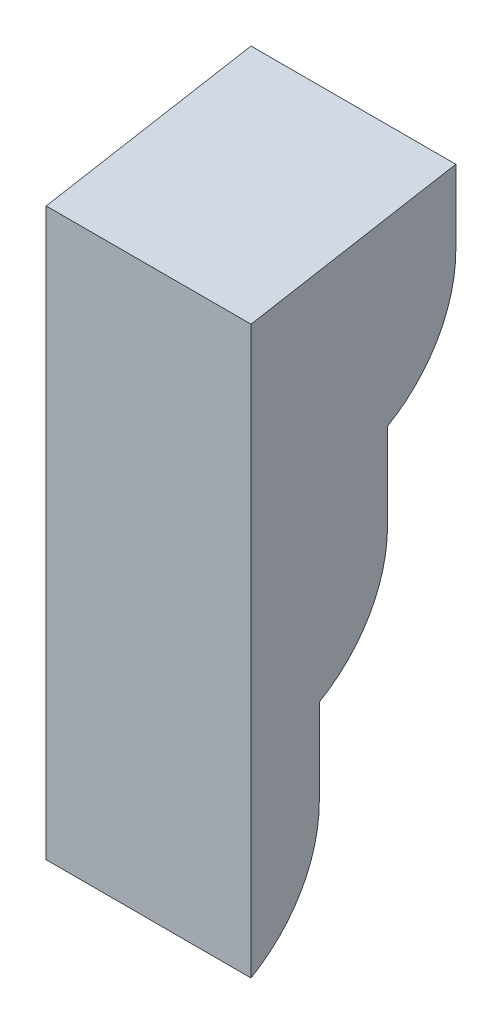
from build123d import *

# Parameters (mm, degrees)
BOSS_EXTRUDE1_DEPTH      = 7.5
BOSS_EXTRUDE1_DEPTH_BACK = 7.5
FILLET1_R                = 10
FILLET2_R                = 10
CUT_EXTRUDE1_DEPTH       = 24.5


with BuildPart() as part:
    # Sketch1 → Boss-Extrude1 (new, two sides: drawn at the far end of the back side and taken through both)
    with BuildSketch(Plane(origin=(0, 0, 0), x_dir=(0, 0, -1), z_dir=(1, 0, 0)).offset(-BOSS_EXTRUDE1_DEPTH_BACK)):
        Polygon((0, 45), (0, 0), (5, 0), (5, 15), (10, 15), (10, 30), (15, 30), (15, 45), align=None)
    extrude(amount=BOSS_EXTRUDE1_DEPTH + BOSS_EXTRUDE1_DEPTH_BACK)

    # Fillet1
    # the kernel refuses this fillet: 10 mm, written as the material it takes off along each edge
    with BuildSketch(Plane(origin=(29.150635095, 30, -15), x_dir=(0, 1, 0), z_dir=(-1, 0, 0))) as fillet1_piece_1:
        with BuildLine():
            CenterArc((8.660254038, -10), FILLET1_R, 90, 60)
            Line((0, -5), (-0.173205081, -4.9))
            ThreePointArc((-0.173205081, -4.9), (-0.2, -2.5), (-0.2, 0))
            Line((-0.2, 0), (0, 0.2))
            Line((0, 0.2), (8.660254038, 0.2))
            Line((8.660254038, 0.2), (8.660254038, 0))
        make_face()
    extrude(amount=58.301270189, mode=Mode.SUBTRACT)

    # Fillet2
    # the kernel refuses this fillet: 10 mm, written as the material it takes off along each edge
    with BuildSketch(Plane(origin=(-29.150635095, 0, -5), x_dir=(0, 0, 1), z_dir=(1, 0, 0))) as fillet2_piece_1:
        with BuildLine():
            CenterArc((10, -8.660254038), FILLET2_R, 120, 60)
            Line((0, -8.660254038), (-0.2, -8.660254038))
            Line((-0.2, -8.660254038), (-0.2, 0))
            Line((-0.2, 0), (0, 0.2))
            ThreePointArc((0, 0.2), (2.5, 0.2), (4.9, 0.173205081))
            Line((4.9, 0.173205081), (5, 0))
        make_face()
    extrude(amount=58.301270189, mode=Mode.SUBTRACT)
    with BuildSketch(Plane(origin=(-29.150635095, 15, -10), x_dir=(0, 1, 0), z_dir=(1, 0, 0))) as fillet2_piece_2:
        with BuildLine():
            CenterArc((8.660254038, 10), FILLET2_R, 210, 60)
            Line((0, 5), (-0.173205081, 4.9))
            ThreePointArc((-0.173205081, 4.9), (-0.2, 2.5), (-0.2, 0))
            Line((-0.2, 0), (0, -0.2))
            Line((0, -0.2), (8.660254038, -0.2))
            Line((8.660254038, -0.2), (8.660254038, 0))
        make_face()
    extrude(amount=58.301270189, mode=Mode.SUBTRACT)

    # Sketch2 → Cut-Extrude1 (cut)
    with BuildSketch(Plane(origin=(7.5, 0, 0), x_dir=(0, 0, -1), z_dir=(1, 0, 0))):
        Polygon((-3.394371736, 45), (20.0100121, 45), (-5.085276302, 40.575023566), align=None)
    extrude(amount=-CUT_EXTRUDE1_DEPTH, mode=Mode.SUBTRACT)


solid = part.part
